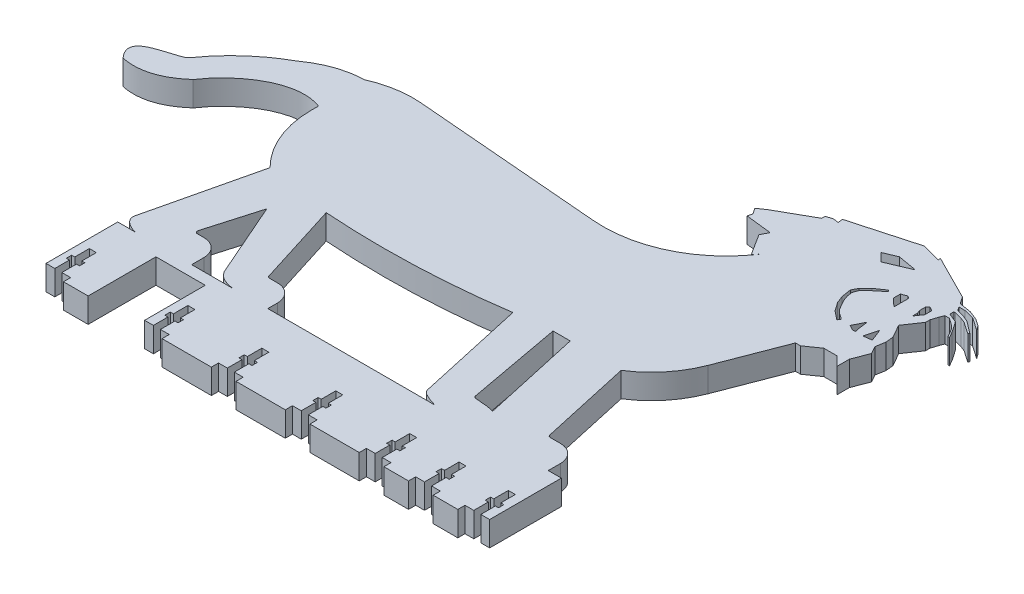
from build123d import *

# Parameters (mm, degrees)
SKETCH1_W           = 10
SKETCH1_H           = 2.907263933
SKETCH1_W_2         = 20
BOSS_EXTRUDE1_DEPTH = 10
SKETCH3_W           = 2.85
SKETCH3_H           = 14
SKETCH3_W_2         = 5.35
SKETCH3_H_2         = 2.2
CUT_EXTRUDE1_DEPTH  = 10
SKETCH5_W           = 35
SKETCH5_H           = 65
BOSS_EXTRUDE2_DEPTH = 10
CUT_EXTRUDE2_DEPTH  = 10
FILLET1_R           = 40
FILLET2_R           = 40
FILLET3_R           = 7
FILLET4_R           = 40
CUT_EXTRUDE3_DEPTH  = 10
CUT_EXTRUDE4_DEPTH  = 10
CUT_EXTRUDE5_DEPTH  = 10
CUT_EXTRUDE6_DEPTH  = 10
FILLET5_R           = 50
FILLET6_R           = 3
FILLET7_R           = 1
CUT_EXTRUDE7_DEPTH  = 10
BOSS_EXTRUDE3_DEPTH = 10
BOSS_EXTRUDE4_START = -10
BOSS_EXTRUDE4_DEPTH = 10
CUT_EXTRUDE8_DEPTH  = 10


# Read off the part's stored shape, not the designer's step: Boss-Extrude4
with BuildPart() as part:
    # Sketch1 → Boss-Extrude1 (new body)
    with BuildSketch(Plane(origin=(0, 0, 0), x_dir=(1, 0, 0), z_dir=(0, 1, 0))):
        Polygon((80, -48.454398885), (90, -48.454398885), (90, 48.454398885), (-90, 48.454398885), (-90, -48.454398885), (-80, -48.454398885), (-70, -48.454398885), (-70, -23.839564252), (-50, -23.839564252), (-50, -48.454398885), (-40, -48.454398885), (-20, -48.454398885), (-10, -48.454398885), (10, -48.454398885), (20, -48.454398885), (40, -48.454398885), (50, -48.454398885), (60, -48.454398885), (70, -48.454398885), align=None)
        with Locations((-75, -49.908030852)):
            Rectangle(SKETCH1_W, SKETCH1_H)
        with Locations((-30, -49.908030852)):
            Rectangle(SKETCH1_W_2, SKETCH1_H)
        with Locations((0, -49.908030852)):
            Rectangle(SKETCH1_W_2, SKETCH1_H)
        with Locations((30, -49.908030852)):
            Rectangle(SKETCH1_W_2, SKETCH1_H)
        with Locations((55, -49.908030852)):
            Rectangle(SKETCH1_W, SKETCH1_H)
        with Locations((75, -49.908030852)):
            Rectangle(SKETCH1_W, SKETCH1_H)
    extrude(amount=BOSS_EXTRUDE1_DEPTH)

    # Sketch3 → Cut-Extrude1 (cut)
    with BuildSketch(Plane(origin=(0, 10, 0), x_dir=(1, 0, 0), z_dir=(0, 1, 0))):
        with Locations((-85, -41.454398885)):
            Rectangle(SKETCH3_W, SKETCH3_H)
        with Locations((-85, -41.454398885)):
            Rectangle(SKETCH3_W_2, SKETCH3_H_2)
        with Locations((-45, -41.454398885)):
            Rectangle(SKETCH3_W, SKETCH3_H)
        with Locations((-45, -41.454398885)):
            Rectangle(SKETCH3_W_2, SKETCH3_H_2)
        with Locations((-15, -41.454398885)):
            Rectangle(SKETCH3_W, SKETCH3_H)
        with Locations((-15, -41.454398885)):
            Rectangle(SKETCH3_W_2, SKETCH3_H_2)
        with Locations((15, -41.454398885)):
            Rectangle(SKETCH3_W, SKETCH3_H)
        with Locations((15, -41.454398885)):
            Rectangle(SKETCH3_W_2, SKETCH3_H_2)
        with Locations((45, -41.454398885)):
            Rectangle(SKETCH3_W, SKETCH3_H)
        with Locations((45, -41.454398885)):
            Rectangle(SKETCH3_W_2, SKETCH3_H_2)
        with Locations((65, -41.454398885)):
            Rectangle(SKETCH3_W, SKETCH3_H)
        with Locations((65, -41.454398885)):
            Rectangle(SKETCH3_W_2, SKETCH3_H_2)
        with Locations((85, -41.454398885)):
            Rectangle(SKETCH3_W, SKETCH3_H)
        with Locations((85, -41.454398885)):
            Rectangle(SKETCH3_W_2, SKETCH3_H_2)
    extrude(amount=-CUT_EXTRUDE1_DEPTH, mode=Mode.SUBTRACT)

    # Sketch5 → Boss-Extrude2 (add)
    with BuildSketch(Plane(origin=(0, 10, 0), x_dir=(1, 0, 0), z_dir=(0, 1, 0))):
        with Locations((107.5, 108.148344789)):
            Rectangle(SKETCH5_W, SKETCH5_H)
        Polygon((-150, 140.648344789), (-150, -19.351655211), (-90, -19.351655211), (90, -19.351655211), (90, 140.648344789), align=None)
    extrude(amount=-BOSS_EXTRUDE2_DEPTH)

    # Sketch7 → Cut-Extrude2 (cut)
    with BuildSketch(Plane(origin=(0, 10, 0), x_dir=(1, 0, 0), z_dir=(0, 1, 0))):
        with BuildLine():
            Line((-150, -19.351655211), (-90, -19.351655211))
            Line((-90, -19.351655211), (-78.191815645, 30.648344789))
            Line((-78.191815645, 30.648344789), (-90, 30.648344789))
            Line((-90, 30.648344789), (-90, 62.105140663))
            add(Edge.make_bspline(
                [(-124.777261001, 45.965077246), (-117.867911877, 56.380119687), (-103.249324814, 67.053242627), (-90, 62.105140663)],
                knots=[0, 0, 0, 0, 1, 1, 1, 1], degree=3))
            add(Edge.make_bspline(
                [(-124.777261001, 45.965077246), (-135.030260394, 36.891898086), (-146.502428273, 39.305198037)],
                knots=[0, 0, 0, 1, 1, 1], degree=2))
            add(Edge.make_bspline(
                [(-146.502428273, 39.305198037), (-155.605940626, 49.471737245), (-135.700440338, 49.640173218), (-133.093339378, 52.998453276)],
                knots=[0, 0, 0, 0, 1, 1, 1, 1], degree=3))
            add(Edge.make_bspline(
                [(-133.093339378, 52.998453276), (-124.049830784, 65.826972523), (-110.409485486, 73.41154727)],
                knots=[0, 0, 0, 1, 1, 1], degree=2))
            add(Edge.make_bspline(
                [(-110.409485486, 73.41154727), (-100.788752611, 80.424513252), (-90, 80.648344789)],
                knots=[0, 0, 0, 0.938140721, 0.938140721, 0.938140721], degree=2))
            Line((-90, 80.648344789), (-90, 85.648344789))
            Line((-90, 85.648344789), (29.969148355, 75.648344789))
            Line((29.969148355, 75.648344789), (36.609038416, 75.648344789))
            Line((36.609038416, 75.648344789), (59.984574177, 112.91645142))
            Line((59.984574177, 112.91645142), (43.609038416, 120.089812939))
            Line((43.609038416, 120.089812939), (43.609038416, 140.648344789))
            Line((43.609038416, 140.648344789), (-150, 140.648344789))
            Line((-150, 140.648344789), (-150, -19.351655211))
        make_face()
        Polygon((-60, -7.351655211), (-60, -19.351655211), (-49.12514792, -19.351655211), (-64.380108323, 15.517061493), (-71, -7.351655211), align=None)
        Polygon((-29.12514792, -8.351655211), (-29.12514792, -19.351655211), (32.684961164, -19.351655211), (21.609038416, 30.648344789), (-52.365371234, 30.648344789), (-40.12514792, -8.351655211), align=None)
        Polygon((84.684961164, -7.351655211), (84.684961164, -19.351655211), (90, -19.351655211), (90, 75.648344789), (72.684961164, 30.648344789), (64.267259875, 30.648344789), (72.684961164, -7.351655211), align=None)
        Polygon((43.855535595, -8.689782755), (52.32315965, -8.689782755), (43.609038416, 30.648344789), (36.609038416, 30.648344789), align=None)
    extrude(amount=-CUT_EXTRUDE2_DEPTH, mode=Mode.SUBTRACT)

    # Fillet1
    # the kernel refuses this fillet: 40 mm, written as the material it takes off along each edge
    with BuildSketch(Plane(origin=(-90, 59.37246351, -85.648344789), x_dir=(0, 0, 1), z_dir=(0, -1, 0))) as fillet1_piece_1:
        with BuildLine():
            CenterArc((41.502242448, -16.358065175), FILLET1_R, 155.861005204, 28.90385588)
            Line((1.640482824, -19.680732725), (0.843247631, -19.747186076))
            Line((0.843247631, -19.747186076), (-0.797235192, -0.066453351))
            Line((-0.797235192, -0.066453351), (0, 0.8))
            ThreePointArc((0, 0.8), (2.5, 0.8), (4.269955151, 0.327161303))
            Line((4.269955151, 0.327161303), (5, 0))
        make_face()
    extrude(amount=108.744927019, mode=Mode.SUBTRACT)

    # Fillet2
    # the kernel refuses this fillet: 40 mm, written as the material it takes off along each edge
    with BuildSketch(Plane(origin=(-90, 80.941064037, -30.648344789), x_dir=(1, 0, 0), z_dir=(0, -1, 0))) as fillet2_piece_1:
        with BuildLine():
            CenterArc((40, -28.376425615), FILLET2_R, 134.813016379, 45.186983621)
            Line((0, -28.376425615), (-0.8, -28.376425615))
            Line((-0.8, -28.376425615), (-0.8, 0))
            Line((-0.8, 0), (0, 0.8))
            ThreePointArc((0, 0.8), (5.904092178, 0.8), (11.244348043, 0.567528512))
            Line((11.244348043, 0.567528512), (11.808184355, 0))
        make_face()
    extrude(amount=151.882128073, mode=Mode.SUBTRACT)

    # Fillet3
    fillet3_edges = [part.edges().sort_by_distance(p)[0] for p in [
        (84.684961164, 5, 7.351655211),
        (-60, 5, 7.351655211),
        (-29.12514792, 5, 8.351655211),
    ]]
    fillet(fillet3_edges, radius=FILLET3_R)

    # Fillet4
    # the kernel refuses this fillet: 40 mm, written as the material it takes off along each edge
    with BuildSketch(Plane(origin=(72.684961164, 61.960393151, -30.648344789), x_dir=(-1, 0, 0), z_dir=(0, -1, 0))) as fillet4_piece_1:
        with BuildLine():
            CenterArc((29.86794558, 33.762212899), FILLET4_R, 201.045659072, 36.525203251)
            Line((-7.46383627, 19.39774062), (-8.210471907, 19.110451174))
            Line((-8.210471907, 19.110451174), (-0.746635637, -0.287289446))
            Line((-0.746635637, -0.287289446), (0, -0.8))
            ThreePointArc((0, -0.8), (4.208850644, -0.8), (7.988696403, -0.675244258))
            Line((7.988696403, -0.675244258), (8.417701289, 0))
        make_face()
    extrude(amount=113.920786302, mode=Mode.SUBTRACT)

    # Sketch8 → Cut-Extrude3 (cut)
    with BuildSketch(Plane(origin=(0, 10, 0), x_dir=(1, 0, 0), z_dir=(0, 1, 0))):
        with BuildLine():
            Line((-88.786091762, -14.211541366), (-90, -19.351655211))
            Line((-90, -19.351655211), (-83, -19.351655211))
            add(Edge.make_bspline(
                [(-83, -19.351655211), (-88.686389875, -17.66490374), (-88.786091762, -14.211541366)],
                knots=[0, 0, 0, 0.738496949, 0.738496949, 0.738496949], degree=2))
        make_face()
    extrude(amount=-CUT_EXTRUDE3_DEPTH, mode=Mode.SUBTRACT)

    # Sketch8<4> → Cut-Extrude4 (cut)
    with BuildSketch(Plane(origin=(0, 10, 0), x_dir=(1, 0, 0), z_dir=(0, 1, 0))):
        with BuildLine():
            Line((-50.987725639, -15.094305923), (-49.12514792, -19.351655211))
            Line((-49.12514792, -19.351655211), (-43.12514792, -19.351655211))
            add(Edge.make_bspline(
                [(-43.12514792, -19.351655211), (-48.791406278, -18.818227747), (-50.987725639, -15.094305923)],
                knots=[0, 0, 0, 0.810961807, 0.810961807, 0.810961807], degree=2))
        make_face()
    extrude(amount=-CUT_EXTRUDE4_DEPTH, mode=Mode.SUBTRACT)

    # Sketch8<5> → Cut-Extrude5 (cut)
    with BuildSketch(Plane(origin=(0, 10, 0), x_dir=(1, 0, 0), z_dir=(0, 1, 0))):
        with BuildLine():
            Line((32.012970706, -16.318090996), (32.684961164, -19.351655211))
            Line((32.684961164, -19.351655211), (38.684961164, -19.351655211))
            add(Edge.make_bspline(
                [(38.684961164, -19.351655211), (33.783951767, -17.97563577), (32.012970706, -16.318090996)],
                knots=[0, 0, 0, 0.435327542, 0.435327542, 0.435327542], degree=2))
        make_face()
    extrude(amount=-CUT_EXTRUDE5_DEPTH, mode=Mode.SUBTRACT)

    # Sketch8<6> → Cut-Extrude6 (cut)
    with BuildSketch(Plane(origin=(0, 10, 0), x_dir=(1, 0, 0), z_dir=(0, 1, 0))):
        with BuildLine():
            Line((52.565364593, -9.783167695), (52.32315965, -8.689782755))
            Line((52.32315965, -8.689782755), (43.855535595, -8.689782755))
            add(Edge.make_bspline(
                [(43.855535595, -8.689782755), (50.321167798, -9.051872194), (52.565364593, -9.783167695)],
                knots=[0, 0, 0, 0.472878179, 0.472878179, 0.472878179], degree=2))
        make_face()
    extrude(amount=-CUT_EXTRUDE6_DEPTH, mode=Mode.SUBTRACT)

    # Fillet5
    fillet5_edges = [part.edges().sort_by_distance(p)[0] for p in [
        (36.609038416, 5, -75.648344789),
    ]]
    fillet(fillet5_edges, radius=FILLET5_R)

    # Fillet6
    fillet6_edges = [part.edges().sort_by_distance(p)[0] for p in [
        (-88.786091762, 5, 14.211541366),
        (-50.987725639, 5, 15.094305923),
        (32.012970706, 5, 16.318090996),
    ]]
    fillet(fillet6_edges, radius=FILLET6_R)

    # Fillet7
    fillet7_edges = [part.edges().sort_by_distance(p)[0] for p in [
        (-71, 5, 7.351655211),
        (-40.12514792, 5, 8.351655211),
        (43.855535595, 5, 8.689782755),
        (72.684961164, 5, 7.351655211),
    ]]
    fillet(fillet7_edges, radius=FILLET7_R)

    # Sketch11 → Cut-Extrude7 (cut)
    with BuildSketch(Plane(origin=(0, 10, 0), x_dir=(1, 0, 0), z_dir=(0, 1, 0))):
        Polygon((43.609038416, 140.648344789), (43.601036663, 120.268827505), (51.522123977, 124.743891347), (51.522123977, 126.175595149), (54.285628087, 126.944004983), (56.34300481, 126.603118939), (56.113079804, 128.596905913), (81.989753249, 135.792078981), (89.74941972, 133.806940505), (89.74941972, 134.719239309), (107.744138422, 125.630940024), (109.640022848, 122.866871693), (114.545584737, 122.054070826), (118.196636608, 120.593650078), (121.067494972, 118.627308732), (122.258021089, 116.891604017), (117.157162742, 120.385342611), (113.081983485, 121.427886794), (110.511747626, 121.427886794), (111.503456312, 119.982044138), (114.054599281, 119.32939082), (117.002731323, 118.150138004), (121.945199021, 114.42700557), (121.712613427, 113.845541586), (117.002731323, 117.071488233), (114.983575577, 117.879150531), (111.826521231, 118.686812829), (111.180391393, 118.686812829), (111.180391393, 117.071488233), (114.983575577, 115.550214559), (117.910599933, 111.282815547), (119.313444929, 108.799709586), (118.699762658, 108.799709586), (116.823446752, 112.120882792), (114.983575577, 113.845541586), (112.494753037, 115.550214559), (110.721893145, 115.550214559), (110.040023956, 113.845541586), (109.147616658, 110.983874027), (109.147616658, 109.258762432), (104.721696926, 102.761805942), (107.744138422, 97.500518893), (108.086554038, 94.290855767), (107.401722807, 90.420762992), (109.147616658, 87.381614437), (106.640477796, 80.842730183), (106.640477796, 75.882174551), (102.986854928, 79.535797419), (97.594967013, 79.535797419), (91.90170989, 75.554498732), (125, 75.648344789), (125, 140.648344789), align=None)
        Polygon((101.267951914, 91.777392556), (104.604128849, 92.212348443), (102.655913299, 97.202765923), align=None)
        Polygon((97.269881636, 91.674212554), (98.233330304, 91.942105563), (97.772999661, 93.641528138), (97.269881636, 97.500518893), (94.925330404, 92.858336832), align=None)
        Polygon((96.402470501, 114.970821366), (94.10435999, 114.118484879), (94.10435999, 111.25681732), (97.311745622, 108.250277562), (97.311745622, 114.118484879), align=None)
        Polygon((104.643272493, 115.529232965), (103.773851771, 114.676896478), (103.773851771, 112.244716749), (104.282743873, 110.872617459), (104.282743873, 108.808689161), (106.330888056, 111.815228919), (106.330888056, 114.676896478), align=None)
        Polygon((78.820580477, 121.427886794), (88.67297326, 125.630940024), (80.771680028, 126.982681912), (75.556167016, 124.757732168), align=None)
    extrude(amount=-CUT_EXTRUDE7_DEPTH, mode=Mode.SUBTRACT)

    # Sketch11<4> → Boss-Extrude3 (add)
    with BuildSketch(Plane(origin=(0, 10, 0), x_dir=(1, 0, 0), z_dir=(0, 1, 0))):
        Polygon((43.609038416, 120.089812939), (43.601036663, 120.268827505), (37.623181804, 116.891604017), (34.424881144, 114.697878072), (36.024031474, 112.366427524), (35.53639007, 110.460296189), (46.100909727, 109.258762432), (44.572652891, 106.232833046), (50.005985163, 97.67073761), (61.969487143, 112.366427524), align=None)
    extrude(amount=-BOSS_EXTRUDE3_DEPTH)

    # Boss-Extrude4 outline → Boss-Extrude4 (add)
    with BuildSketch(Plane(origin=(0, 10, 0), x_dir=(1, 0, 0), z_dir=(0, 1, 0)).offset(BOSS_EXTRUDE4_START)):
        with BuildLine():
            Line((-52.365371234, 30.648344789), (-50.974238951, 26.215896323))
            add(Edge.make_bspline(
                [(-50.974238951, 26.215896323), (-14.050080978, 23.648484034), (21.975779618, 28.99276624)],
                knots=[0, 0, 0, 0.727735303, 0.727735303, 0.727735303], degree=2))
            Line((21.975779618, 28.99276624), (21.609038416, 30.648344789))
            Line((21.609038416, 30.648344789), (-52.365371234, 30.648344789))
        make_face()
    extrude(amount=BOSS_EXTRUDE4_DEPTH)

    # Sketch13 → Cut-Extrude8 (cut)
    with BuildSketch(Plane(origin=(0, 10, 0), x_dir=(1, 0, 0), z_dir=(0, 1, 0))):
        Polygon((90.296345108, 113.088675007), (90.846479994, 112.538540121), (87.610471186, 109.852666199), (85.339463444, 107.96773917), (84.304802117, 106.54699713), (83.737270796, 104.719363175), (84.021036456, 102.747208137), (84.82213278, 100.486445045), (85.961484933, 98.446967308), (87.035654692, 96.524168195), (88.558957422, 94.947382886), (90.250727082, 93.799072406), (91.058498235, 93.153895323), (90.250727082, 92.142554013), (86.739040268, 94.947382886), (84.304802117, 98.446967308), (83.159381866, 101.429596276), (82.506381419, 105.389947371), (83.737270796, 107.729919363), (86.353386254, 110.346034821), align=None)
    extrude(amount=-CUT_EXTRUDE8_DEPTH, mode=Mode.SUBTRACT)


solid = part.part
